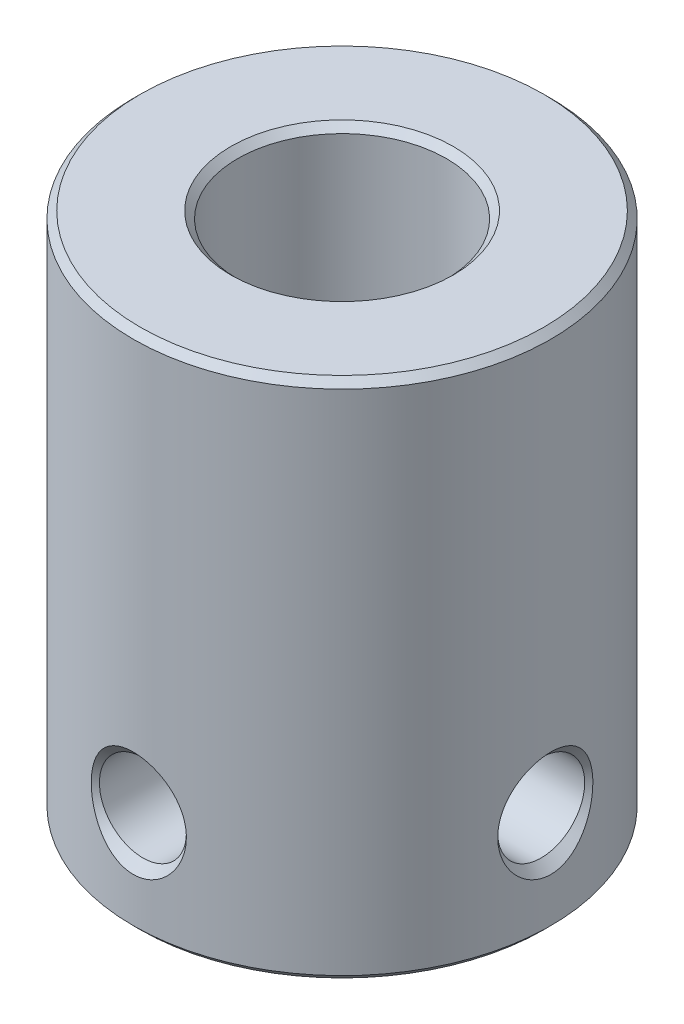
from build123d import *

# Parameters (mm, degrees)
PROFILES_R        = 6
PROFILES_R_2      = 3
PROFILE_DEPTH     = 7.5
CIRPATTERN1_COUNT = 2
CIRPATTERN1_ANGLE = 90
OUTERC_SIZE       = 0.2
INNERC_SIZE       = 0.2


# Read off the part's stored shape, not the designer's step: M3x0.5 Tapped Hole1
with BuildPart() as part:
    # ProfileS → Profile (new, symmetric)
    with BuildSketch(Plane(origin=(0, 0, 0), x_dir=(1, 0, 0), z_dir=(0, 1, 0))):
        with Locations(Location((0, 0, 0), (0, 0, 270))):
            Circle(PROFILES_R)
        with Locations(Location((0, 0, 0), (0, 0, 270))):
            Circle(PROFILES_R_2, mode=Mode.SUBTRACT)
    extrude(amount=PROFILE_DEPTH, both=True)

    # M3x0.5 Tapped Hole1 outline → M3x0.5 Tapped Hole1 (revolve, cut)
    with BuildSketch(Plane.XZ.offset(4.5)):
        Polygon((1.525000084, 6.000000084), (0, 6.000000084), (0, 2.727054604), (1.25, 2.727054604), (1.25, 5.725), align=None)
    m3x0_5_tapped_hole1 = revolve(axis=Axis((0, -4.5, 0), (0, 0, 1)), mode=Mode.SUBTRACT)

    # CirPattern1: M3x0.5 Tapped Hole1 ×2 about axis
    cirpattern1_axis = Axis((0, 7.5, 0), (0, 1, 0))
    for i in range(1, CIRPATTERN1_COUNT):
        add(m3x0_5_tapped_hole1.rotate(cirpattern1_axis, i * CIRPATTERN1_ANGLE / (CIRPATTERN1_COUNT - 1)), mode=Mode.SUBTRACT)

    # OuterC
    outerc_edges = [part.edges().sort_by_distance(p)[0] for p in [
        (0, -7.5, -6),
        (0, 7.5, -6),
    ]]
    chamfer(outerc_edges, length=OUTERC_SIZE)

    # InnerC
    innerc_edges = [part.edges().sort_by_distance(p)[0] for p in [
        (0, -7.5, -3),
        (0, 7.5, -3),
    ]]
    chamfer(innerc_edges, length=INNERC_SIZE)


solid = part.part
